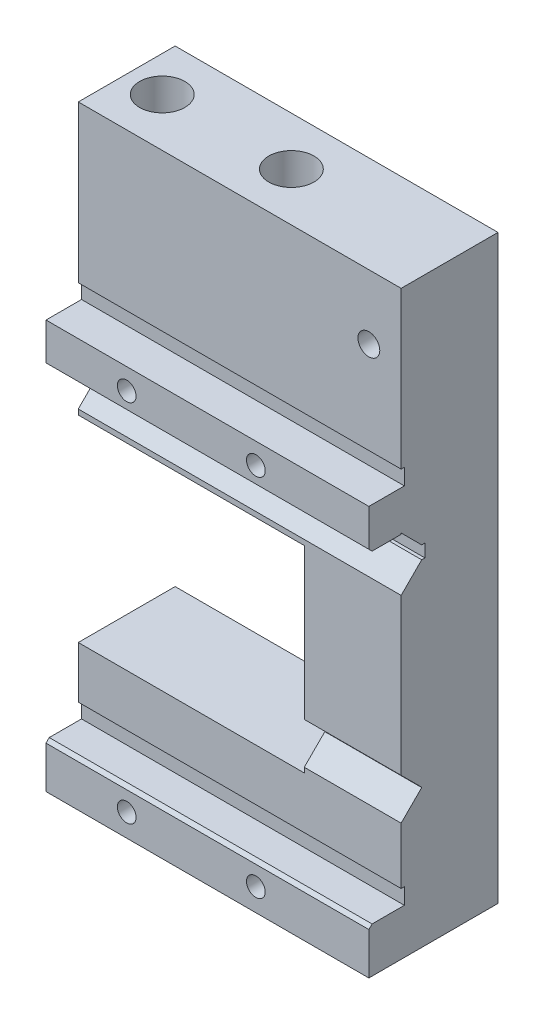
from build123d import *

# Parameters (mm, degrees)
BOSS_EXTRUDE1_DEPTH         = 30
SKETCH2_W                   = 1
SKETCH2_H                   = 5
CUT_EXTRUDE1_DEPTH          = 300
SKETCH11_W                  = 100
SKETCH11_H                  = 14
SKETCH11_H_2                = 12.5
BOSS_EXTRUDE2_DEPTH         = 10
SKETCH3_R                   = 3
CUT_EXTRUDE2_DEPTH          = 100
SKETCH4_R                   = 7
CUT_EXTRUDE3_DEPTH          = 70
LPATTERN1_COUNT             = 2
LPATTERN1_PITCH             = 40
SKETCH9_R                   = 3.381759822
CUT_EXTRUDE8_DEPTH          = 100
CUT_EXTRUDE9_START          = -10
SKETCH10_R                  = 6.982534733
CUT_EXTRUDE9_DEPTH          = 20
LPATTERN4_COUNT             = 2
LPATTERN4_PITCH             = 140
SKETCH7_R                   = 2.900161541
CUT_EXTRUDE6_DEPTH          = 40
SKETCH8_R                   = 5.870976625
CUT_EXTRUDE7_DEPTH          = 25
PATTERN_LINEAR_1_COUNT      = 2
PATTERN_LINEAR_1_PITCH      = 40
PATTERN_LINEAR_1_COUNT_DIR2 = 2
PATTERN_LINEAR_1_PITCH_DIR2 = 113
SKETCH_1_W                  = 1
SKETCH_1_H                  = 5
CUT_EXTRUDE_1_DEPTH         = 200
CHAMFER_1_SIZE              = 1
SKETCH_3_R                  = 40
CUT_EXTRUDE_3_DEPTH         = 30
FILLET_1_R                  = 3


with BuildPart() as part:
    # Sketch1 → Boss-Extrude1 (new body)
    with BuildSketch(Plane.XY):
        Polygon((-23.103448276, -43.572275418), (-23.103448276, -8.572275418), (46.896551724, -8.572275418), (46.896551724, 52.427724582), (-23.103448276, 52.427724582), (-23.103448276, 136.427724582), (76.896551724, 136.427724582), (76.896551724, -43.572275418), align=None)
    extrude(amount=BOSS_EXTRUDE1_DEPTH)

    # Sketch2 → Cut-Extrude1 (cut)
    with BuildSketch(Plane.ZY.offset(23.103448276)):
        Polygon((30, 5.791685612), (23.636038969, -0.572275418), (23.636038969, -0.672275418), (30, -7.036236449), align=None)
        Polygon((30, 70.791685612), (23.636038969, 64.427724582), (22.636038969, 64.427724582), (22.636038969, 60.427724582), (23.636038969, 60.427724582), (30, 54.063763551), align=None)
        with Locations((29.5, -27.072275418)):
            Rectangle(SKETCH2_W, SKETCH2_H)
    extrude(amount=-CUT_EXTRUDE1_DEPTH, mode=Mode.SUBTRACT)

    # Sketch11 → Boss-Extrude2 (add)
    with BuildSketch(Plane.XY.offset(30)):
        with Locations((26.896551724, -36.572275418)):
            Rectangle(SKETCH11_W, SKETCH11_H)
        with Locations((26.896551724, 76.677724582)):
            Rectangle(SKETCH11_W, SKETCH11_H_2)
    extrude(amount=BOSS_EXTRUDE2_DEPTH)

    # Sketch3 → Cut-Extrude2 (cut)
    with BuildSketch(Plane(origin=(0, 136.427724582, 0), x_dir=(1, 0, 0), z_dir=(0, 1, 0))):
        with Locations(Location((-12.103448276, -15, 0), (0, 0, 270))):
            Circle(SKETCH3_R)
    cut_extrude2 = extrude(amount=-CUT_EXTRUDE2_DEPTH, mode=Mode.SUBTRACT)

    # Sketch4 → Cut-Extrude3 (cut)
    with BuildSketch(Plane(origin=(0, 136.427724582, 0), x_dir=(1, 0, 0), z_dir=(0, 1, 0))):
        with Locations(Location((-12.103448276, -15, 0), (0, 0, 270))):
            Circle(SKETCH4_R)
    cut_extrude3 = extrude(amount=-CUT_EXTRUDE3_DEPTH, mode=Mode.SUBTRACT)

    # LPattern1: Cut-Extrude2, Cut-Extrude3 ×2
    with Locations(*[(i * LPATTERN1_PITCH, 0, 0) for i in range(1, LPATTERN1_COUNT)]):
        add(cut_extrude2, mode=Mode.SUBTRACT)
        add(cut_extrude3, mode=Mode.SUBTRACT)

    # Sketch9 → Cut-Extrude8 (cut)
    with BuildSketch(Plane(origin=(0, 0, 0), x_dir=(-1, 0, 0), z_dir=(0, 0, -1))):
        with Locations((-66.896551724, 116.427724582)):
            Circle(SKETCH9_R)
    cut_extrude8 = extrude(amount=-CUT_EXTRUDE8_DEPTH, mode=Mode.SUBTRACT)

    # Sketch10 → Cut-Extrude9 (cut)
    with BuildSketch(Plane.XY.offset(30).offset(CUT_EXTRUDE9_START)):
        with Locations((66.896551724, 116.427724582)):
            Circle(SKETCH10_R)
    cut_extrude9 = extrude(amount=-CUT_EXTRUDE9_DEPTH, mode=Mode.SUBTRACT)

    # LPattern4: Cut-Extrude8, Cut-Extrude9 ×2
    with Locations(*[(-i * LPATTERN4_PITCH, 0, 0) for i in range(1, LPATTERN4_COUNT)]):
        add(cut_extrude8, mode=Mode.SUBTRACT)
        add(cut_extrude9, mode=Mode.SUBTRACT)

    # Sketch7 → Cut-Extrude6 (cut)
    with BuildSketch(Plane(origin=(0, 0, 0), x_dir=(-1, 0, 0), z_dir=(0, 0, -1))):
        with Locations((-1.896551724, -36.572275418)):
            Circle(SKETCH7_R)
    cut_extrude6 = extrude(amount=-CUT_EXTRUDE6_DEPTH, mode=Mode.SUBTRACT)

    # Sketch8 → Cut-Extrude7 (cut)
    with BuildSketch(Plane(origin=(0, 0, 0), x_dir=(-1, 0, 0), z_dir=(0, 0, -1))):
        with Locations((-1.896551724, -36.572275418)):
            Circle(SKETCH8_R)
    cut_extrude7 = extrude(amount=-CUT_EXTRUDE7_DEPTH, mode=Mode.SUBTRACT)

    # Линейный массив1: Cut-Extrude6, Cut-Extrude7 2 × 2
    with Locations(*[(i * PATTERN_LINEAR_1_PITCH, j * PATTERN_LINEAR_1_PITCH_DIR2, 0) for i in range(PATTERN_LINEAR_1_COUNT) for j in range(PATTERN_LINEAR_1_COUNT_DIR2) if (i, j) != (0, 0)]):
        add(cut_extrude6, mode=Mode.SUBTRACT)
        add(cut_extrude7, mode=Mode.SUBTRACT)

    # Эскиз1 → Вырез-Вытянуть1 (cut)
    with BuildSketch(Plane.ZY.offset(23.103448276)):
        with Locations((29.5, 85.427724582)):
            Rectangle(SKETCH_1_W, SKETCH_1_H)
    extrude(amount=-CUT_EXTRUDE_1_DEPTH, mode=Mode.SUBTRACT)

    # Фаска1
    chamfer_1_edges = [part.edges().sort_by_distance(p)[0] for p in [
        (26.896551724, 70.427724582, 40),
        (26.896551724, -29.572275418, 40),
    ]]
    chamfer(chamfer_1_edges, length=CHAMFER_1_SIZE)

    # Эскиз3 → Вырез-Вытянуть3 (cut)
    with BuildSketch(Plane.XZ.offset(43.572275418)):
        with Locations((-59.800747668, -15)):
            Circle(SKETCH_3_R)
    extrude(amount=-CUT_EXTRUDE_3_DEPTH, mode=Mode.SUBTRACT)

    # Скругление1
    # the kernel refuses this fillet: 3 mm, written as the material it takes off along each edge
    with BuildSketch(Plane(origin=(-22.719755232, -13.572275418, 0), x_dir=(-0.3864755051047792, 0, 0.9222996714484971), z_dir=(0, -1, 0))) as fillet_1_piece_1:
        with BuildLine():
            CenterArc((2.081301731, -2.795561642), FILLET_1_R, 111.274329899, 45.990298087)
            Line((-0.685597284, -1.636135127), (-0.740935264, -1.612946597))
            Line((-0.740935264, -1.612946597), (-0.05533798, 0.02318853))
            Line((-0.05533798, 0.02318853), (0.0007446, 0.05999538))
            ThreePointArc((0.0007446, 0.05999538), (0.49640021, 0.056919717), (0.971030393, 0.055911233))
            Line((0.971030393, 0.055911233), (0.992800419, 0))
        make_face()
    extrude(amount=34.434933616, mode=Mode.SUBTRACT)


solid = part.part
